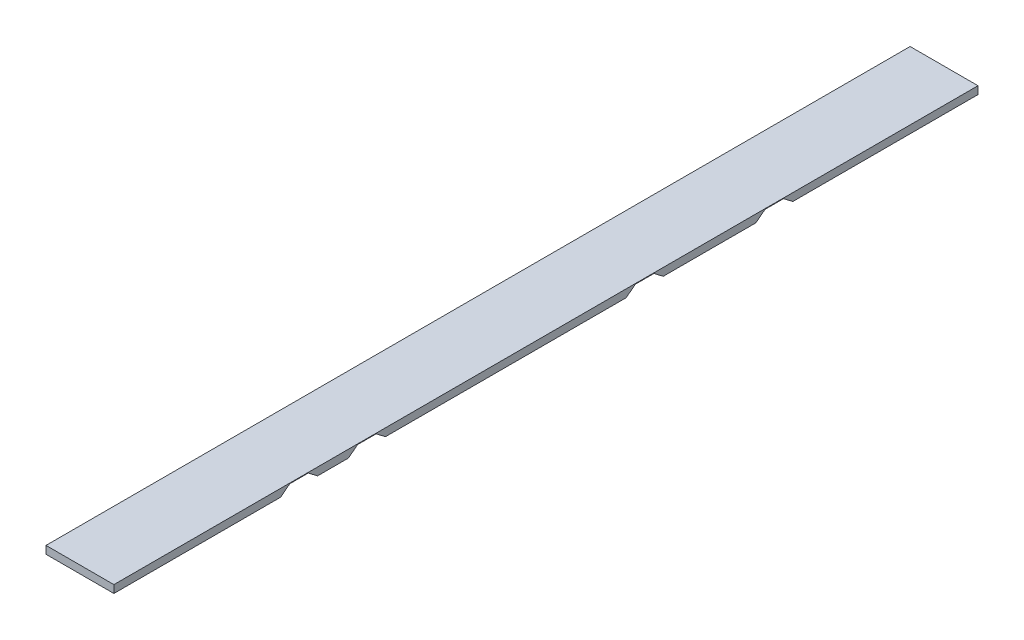
from build123d import *

# Parameters (mm, degrees)
BOSS_EXTRUDE1_DEPTH = 110


with BuildPart() as part:
    # Sketch1 → Boss-Extrude1 (new body)
    with BuildSketch(Plane(origin=(0, 0, 0), x_dir=(0, 0, -1), z_dir=(1, 0, 0))):
        Polygon((1400, 0), (1400, 12.5), (0, 12.5), (0, 0), (270, 0), (285, 11.5), (315, 11.5), (330, 0), (380, 0), (395, 11.5), (425, 11.5), (440, 0), (830, 0), (845, 11.5), (875, 11.5), (890, 0), (1040, 0), (1055, 11.5), (1085, 11.5), (1100, 0), align=None)
    extrude(amount=BOSS_EXTRUDE1_DEPTH)


solid = part.part
